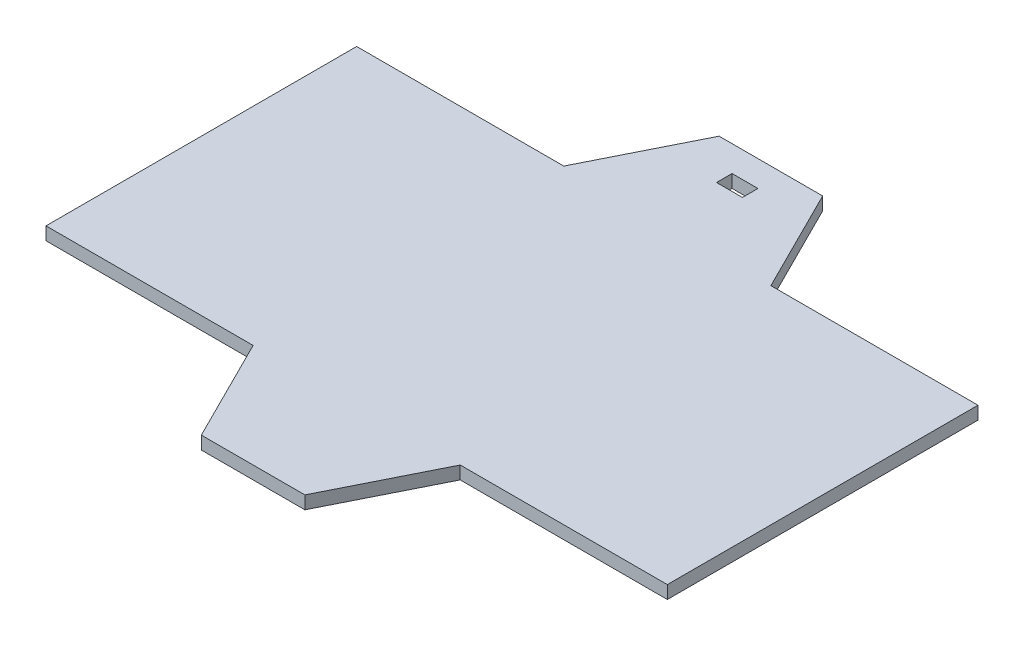
from build123d import *

# Parameters (mm, degrees)
BOSS_EXTRUDE1_DEPTH = 6.35
SKETCH2_W           = 12.7
SKETCH2_H           = 7.62
CUT_EXTRUDE1_DEPTH  = 367.379042113


with BuildPart() as part:
    # Sketch1 → Boss-Extrude1 (new body)
    with BuildSketch(Plane(origin=(0, 0, 0), x_dir=(1, 0, 0), z_dir=(0, 1, 0))):
        Polygon((0, 0), (0, 152.4), (101.6, 152.4), (127, 203.2), (177.8, 203.2), (203.2, 152.4), (304.8, 152.4), (304.8, 0), (203.2, 0), (177.8, -50.8), (127, -50.8), (101.6, 0), align=None)
    extrude(amount=BOSS_EXTRUDE1_DEPTH)

    # Sketch2 → Cut-Extrude1 (cut, through all)
    with BuildSketch(Plane(origin=(0, 6.35, 0), x_dir=(1, 0, 0), z_dir=(0, 1, 0))):
        with Locations((152.4, 186.69)):
            Rectangle(SKETCH2_W, SKETCH2_H)
    extrude(amount=-CUT_EXTRUDE1_DEPTH, mode=Mode.SUBTRACT)


solid = part.part
